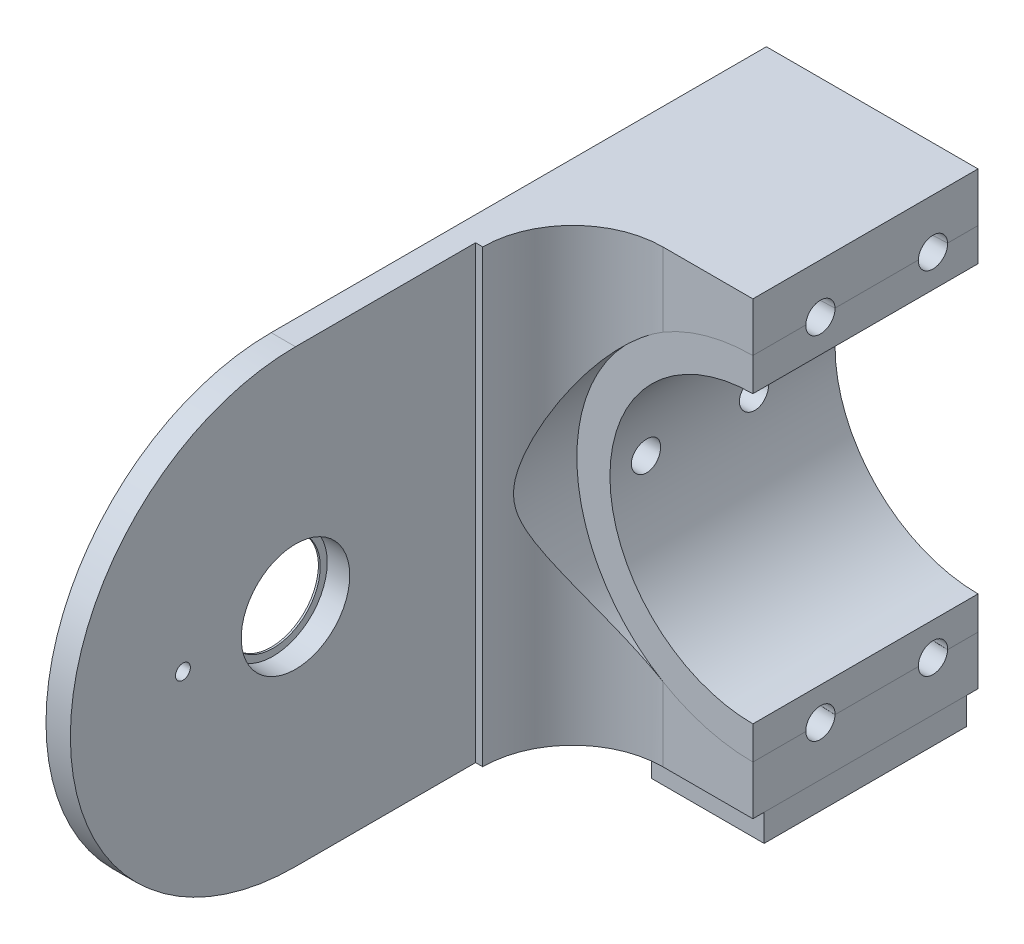
from build123d import *

# Parameters (mm, degrees)
CENTRE_HOLE_FOR_L2_DEPTH      = 40
CENTRE_HOLE_FOR_L2_DEPTH_BACK = 10
SKETCH1_R                     = 39.1
SKETCH1_R_2                   = 31.75
MAIN_STRUCTURE_DEPTH          = 60
MAIN_STRUCTURE_DEPTH_BACK     = 50
SKETCH2_W                     = 100
SKETCH2_H                     = 100
SKETCH2_R                     = 39.1
BEARING_CURVE_DEPTH           = 10
SHAFT_START                   = -10
SHAFT_HOLE_OUTLINE_R          = 10.5
SHAFT_HOLE_DEPTH              = 10
WRIST_CUTOUT_DEPTH            = 188.082869339
SURFACECUT1_DEPTH             = 50
SKETCH13_W                    = 25
SKETCH13_H                    = 45
SKETCH13_R                    = 2.525
BOSS_EXTRUDE1_DEPTH           = 6
SKETCH14_R                    = 3.25
CUT_EXTRUDE2_DEPTH            = 168.7378908
CUT_EXTRUDE3_DEPTH            = 1.5875
SKETCH9_R                     = 12.05
BEARING_DEPTH                 = 5
CUT_EXTRUDE4_DEPTH            = 3
SKETCH17_R                    = 3.25
SKETCH17_R_2                  = 1.65
CUT_EXTRUDE5_DEPTH            = 167.868211501


# Read off the part's stored shape, not the designer's step: Shaft Hole, SurfaceCut1
with BuildPart() as part:
    # Sketch1 → Centre Hole for L2 (new, two sides: drawn at the far end of the back side and taken through both)
    with BuildSketch(Plane.XY.offset(-CENTRE_HOLE_FOR_L2_DEPTH_BACK)):
        Circle(SKETCH1_R)
        Circle(SKETCH1_R_2, mode=Mode.SUBTRACT)
    extrude(amount=CENTRE_HOLE_FOR_L2_DEPTH + CENTRE_HOLE_FOR_L2_DEPTH_BACK)


with BuildPart() as body_2:
    # Sketch2 → Main Structure (new, two sides: drawn at the far end of the back side and taken through both)
    with BuildSketch(Plane.XY.offset(40).offset(-MAIN_STRUCTURE_DEPTH_BACK)):
        Rectangle(SKETCH2_W, SKETCH2_H)
        Circle(SKETCH2_R, mode=Mode.SUBTRACT)
    extrude(amount=MAIN_STRUCTURE_DEPTH + MAIN_STRUCTURE_DEPTH_BACK)

    # Sketch3 → Bearing Curve (add)
    with BuildSketch(Plane.ZY.offset(50)):
        with BuildLine():
            Line((100, 50), (100, -50))
            ThreePointArc((100, -50), (150, 0), (100, 50))
        make_face()
    bearing_curve = extrude(amount=-BEARING_CURVE_DEPTH)

    # Upright Mirror: Bearing Curve across plane
    add(bearing_curve.mirror(Plane(origin=(0, 0, 0), x_dir=(0, 0, 1), z_dir=(1, 0, 0))))

    # Shaft Hole outline → Shaft Hole (cut)
    with BuildSketch(Plane.ZY.offset(50).offset(SHAFT_START)):
        with Locations((100, 0)):
            Circle(SHAFT_HOLE_OUTLINE_R)
    extrude(amount=SHAFT_HOLE_DEPTH, mode=Mode.SUBTRACT)

    # Sketch4 → Wrist Cutout (cut, through all)
    with BuildSketch(Plane(origin=(0, 50, 0), x_dir=(1, 0, 0), z_dir=(0, 1, 0))):
        with BuildLine():
            Line((-40, -100), (-40, -60))
            ThreePointArc((-40, -60), (-34.142135624, -45.857864376), (-20, -40))
            Line((-20, -40), (20, -40))
            ThreePointArc((20, -40), (34.142135624, -45.857864376), (40, -60))
            Line((40, -60), (40, -100))
            Line((40, -100), (-40, -100))
        make_face()
    extrude(amount=-WRIST_CUTOUT_DEPTH, mode=Mode.SUBTRACT)


with BuildPart() as surfacecut1_tool:
    # SurfaceCut1 outline → SurfaceCut1 (new body)
    with BuildSketch(Plane.YZ):
        with BuildLine():
            ThreePointArc((50, 100), (0, 150), (-50, 100))
            Line((-50, 100), (-50, -10))
            Line((-50, -10), (50, -10))
            Line((50, -10), (50, 100))
        make_face()
    extrude(amount=SURFACECUT1_DEPTH)


with BuildPart() as part_1:
    add(part.part)

    # SurfaceCut1: cut by surfacecut1_tool
    add(surfacecut1_tool.part, mode=Mode.SUBTRACT)


with BuildPart() as body_2_1:
    add(body_2.part)

    # SurfaceCut1: cut by surfacecut1_tool
    add(surfacecut1_tool.part, mode=Mode.SUBTRACT)


with BuildPart() as body_3:
    # Sketch13 → Boss-Extrude1 (new body)
    with BuildSketch(Plane(origin=(0, -50, 0), x_dir=(-1, 0, 0), z_dir=(0, -1, 0))):
        with Locations((12.5, -15)):
            Rectangle(SKETCH13_W, SKETCH13_H)
        with Locations(Location((19, -31, 0), (0, 0, 90))):
            Circle(SKETCH13_R, mode=Mode.SUBTRACT)
        with Locations(Location((19, 1, 0), (0, 0, 90))):
            Circle(SKETCH13_R, mode=Mode.SUBTRACT)
    extrude(amount=BOSS_EXTRUDE1_DEPTH)


with BuildPart() as cut_extrude2_tool:
    # Sketch14 → Cut-Extrude2 (new, through all)
    with BuildSketch(Plane.ZY.offset(50)):
        with Locations((8, 0)):
            Circle(SKETCH14_R)
        with Locations((32, 0)):
            Circle(SKETCH14_R)
    extrude(amount=-CUT_EXTRUDE2_DEPTH)


with BuildPart() as part_2:
    add(part_1.part)

    # Cut-Extrude2: cut by cut_extrude2_tool
    add(cut_extrude2_tool.part, mode=Mode.SUBTRACT)


with BuildPart() as body_2_2:
    add(body_2_1.part)

    # Cut-Extrude2: cut by cut_extrude2_tool
    add(cut_extrude2_tool.part, mode=Mode.SUBTRACT)

    # Sketch15 → Cut-Extrude3 (cut)
    with BuildSketch(Plane(origin=(-40, 0, 0), x_dir=(0, 0, -1), z_dir=(1, 0, 0))):
        with BuildLine():
            Line((-60, 50), (-100, 50))
            ThreePointArc((-100, 50), (-150, 0), (-100, -50))
            Line((-100, -50), (-60, -50))
            Line((-60, -50), (-60, 50))
        make_face()
    extrude(amount=-CUT_EXTRUDE3_DEPTH, mode=Mode.SUBTRACT)

    # Sketch9 → Bearing (cut)
    with BuildSketch(Plane(origin=(-41.5875, 0, 0), x_dir=(0, 0, -1), z_dir=(1, 0, 0))):
        with Locations((-100, 0)):
            Circle(SKETCH9_R)
    extrude(amount=-BEARING_DEPTH, mode=Mode.SUBTRACT)

    # Sketch16 → Cut-Extrude4 (cut)
    with BuildSketch(Plane.ZY.offset(50)):
        with BuildLine():
            Line((-10, -50), (100, -50))
            ThreePointArc((100, -50), (150, 0), (100, 50))
            Line((100, 50), (-10, 50))
            Line((-10, 50), (-10, -50))
        make_face()
    extrude(amount=-CUT_EXTRUDE4_DEPTH, mode=Mode.SUBTRACT)


with BuildPart() as cut_extrude5_tool:
    # Sketch17 → Cut-Extrude5 (new, through all)
    with BuildSketch(Plane.ZY.offset(47)):
        with Locations((0, -39)):
            Circle(SKETCH17_R)
        with Locations((25, -39)):
            Circle(SKETCH17_R)
        with Locations(Location((25, 39, 0), (0, 0, 1.763225358))):
            Circle(SKETCH17_R)
        with Locations(Location((0, 39, 0), (0, 0, 1.763225358))):
            Circle(SKETCH17_R)
        with Locations((125, 0)):
            Circle(SKETCH17_R_2)
    extrude(amount=-CUT_EXTRUDE5_DEPTH)


with BuildPart() as part_3:
    add(part_2.part)

    # Cut-Extrude5: cut by cut_extrude5_tool
    add(cut_extrude5_tool.part, mode=Mode.SUBTRACT)


with BuildPart() as body_2_3:
    add(body_2_2.part)

    # Cut-Extrude5: cut by cut_extrude5_tool
    add(cut_extrude5_tool.part, mode=Mode.SUBTRACT)


solid = Compound([body_3.part, part_3.part, body_2_3.part])
